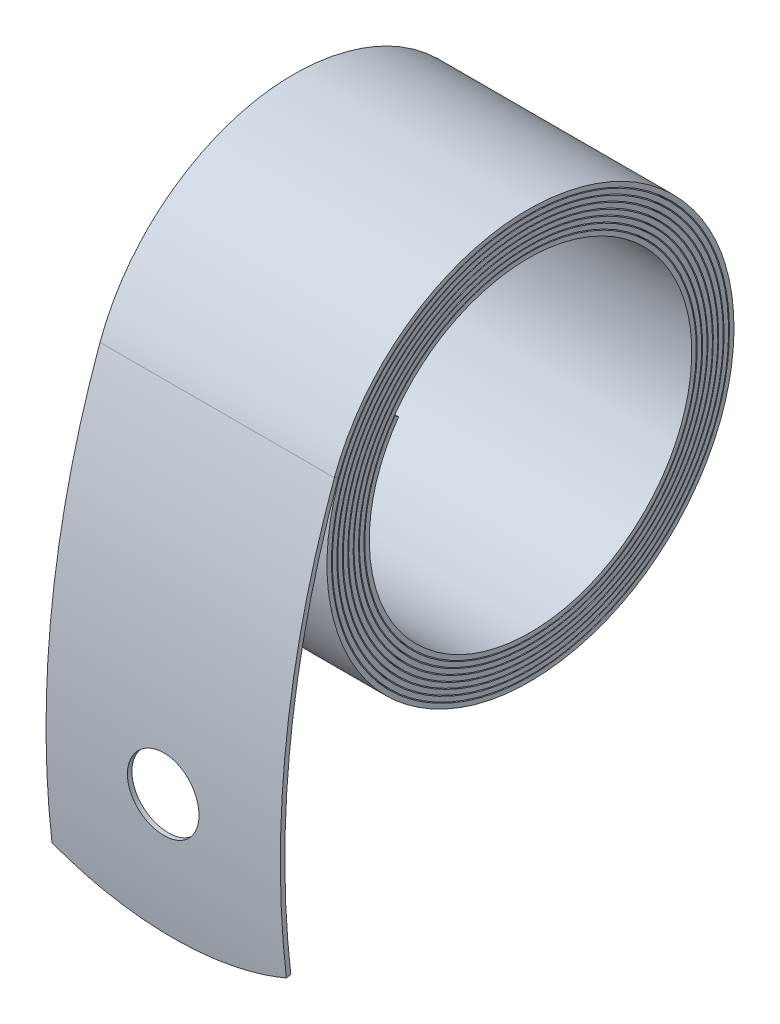
from build123d import *

# Parameters (mm, degrees)
SWEEP1_START            = -7.9375
SWEEP1_DEPTH            = 15.875
CUT_EXTRUDE1_START      = -16.85544
SKETCH7_R               = 2.4257
CUT_EXTRUDE1_DEPTH      = 0.35359
CUT_EXTRUDE2_REACH      = 51.601
CUT_EXTRUDE2_END_RADIUS = 60.32342755


# Read off the part's stored shape, not the designer's step: Sweep1
with BuildPart() as part:
    # Sweep1 outline → Sweep1 (new body)
    with BuildSketch(Plane.YZ.offset(SWEEP1_START)):
        with BuildLine():
            add(Edge.make_bspline(
                [(4.699242082, 12.912908186), (6.395060697, 12.287619771), (7.965017815, 11.323405234), (11.602853027, 7.948237166), (13.134824058, 4.980061507), (13.967034142, -1.264046067), (13.258759366, -4.517388005), (9.928450801, -9.843572635), (7.319403537, -11.896337015), (1.376497278, -13.870441354), (-1.933381846, -13.790349243), (-7.753805311, -11.5353146), (-10.244207049, -9.368638087), (-13.287749645, -3.938118098), (-13.824837394, -0.691921503), (-12.710682309, 5.414852583), (-11.064045327, 8.252226449), (-6.327290896, 12.234201405), (-3.258667915, 13.368730501), (2.909016065, 13.422421691), (5.986606982, 12.341827769), (10.763271714, 8.466212581), (12.441171988, 5.681548978), (13.646910627, -0.332271277), (13.170508656, -3.538414758), (10.274637266, -8.923172378), (7.871222738, -11.084691701), (2.228134103, -13.384785663), (-0.991777141, -13.515770354), (-6.791490356, -11.700711085), (-9.348075581, -9.756464626), (-12.649511028, -4.675406946), (-13.382059771, -1.55820071), (-12.688449236, 4.441822883), (-11.270785511, 7.30308761), (-6.929764819, 11.473587502), (-4.02175236, 12.76867842), (1.96438175, 13.218656974), (5.020532148, 12.366738483), (9.904833456, 8.907261307), (11.714520077, 6.31322956), (13.266904043, 0.552834612), (13.009530703, -2.590647459), (10.546628705, -8.002233868), (8.350010196, -10.25180067), (3.019995317, -12.848599997), (-0.095709603, -13.181583102), (-5.840438211, -11.788310592), (-8.447555513, -10.06774493), (-11.973531427, -5.347450306), (-12.88397394, -2.368691422), (-12.597712046, 3.49593191), (-11.402425856, 6.361579571), (-7.458399657, 10.688726443), (-4.72071016, 12.130704988), (1.059053214, 12.94750291), (4.078921446, 12.319554171), (9.035955292, 9.274210388), (10.957746879, 6.872983236), (12.833945632, 1.387438121), (12.782300852, -1.677853957), (10.74162658, -7.086484365), (8.755632702, -9.407885168), (3.750618085, -12.265040336), (0.75098811, -12.790147148), (-4.907374887, -11.803829929), (-7.546105952, -10.301627221), (-11.267626342, -5.953275521), (-12.337960127, -3.122342706), (-12.438047027, 2.583503677), (-11.462601651, 5.437182641), (-7.913064999, 9.883074563), (-5.352900844, 11.458430558), (0.197128419, 12.616719413), (3.165284606, 12.200812534), (8.164209778, 9.569054855), (10.178050341, 7.362603248), (12.350022842, 2.165558314), (12.495658996, -0.807444852), (10.86083895, -6.179144985), (9.087024209, -8.557277573), (4.419084747, -11.642782038), (1.54529013, -12.343299305), (-3.998550034, -11.751913059), (-6.649692148, -10.462459418), (-10.535874595, -6.48812411), (-11.753053665, -3.814832188), (-12.211801057, 1.707029652), (-11.451966684, 4.534291201), (-8.296116741, 9.064977771), (-5.916240473, 10.754703886), (-0.617344591, 12.232905252), (2.28349366, 12.016755927), (7.295141896, 9.788948496), (9.385355455, 7.781423849), (11.818248333, 2.885811215), (12.151867525, 0.016777643), (10.909521489, -5.287048647), (9.34335531, -7.703399105), (5.024102772, -10.98941265), (2.285964196, -11.848245175), (-3.120139443, -11.632026342), (-5.767714979, -10.553276364), (-9.781666782, -6.951923811), (-11.132776073, -4.443511002), (-11.926347396, 0.870875432), (-11.371066465, 3.656374483), (-8.609171263, 8.241915708), (-6.412291983, 10.026630213), (-1.378479348, 11.797893867), (1.441104977, 11.773640194), (6.431893261, 9.935131271), (8.583908741, 8.128335016), (11.247038474, 3.546890423), (11.752757593, 0.7918258), (10.891934854, -4.416498198), (9.528729126, -6.852215349), (5.560943166, -10.308836658), (2.968340001, -11.313533418), (-2.274550973, -11.446520067), (-4.904507843, -10.574660636), (-9.013252053, -7.346576724), (-10.479959533, -5.006327102), (-11.587950829, 0.079278706), (-11.225919736, 2.80739528), (-8.849345404, 7.419264398), (-6.839890387, 9.283811661), (-2.084970078, 11.31477388), (0.641892275, 11.473641246), (5.581373645, 10.012404435), (7.777107358, 8.402530525), (10.643742368, 4.147206022), (11.305364014, 1.516301768), (10.807450158, -3.573529705), (9.645601207, -6.013010931), (6.029598115, -9.604397122), (3.589762296, -10.742597416), (-1.466387582, -11.202376094), (-4.063512062, -10.527171251), (-8.237999239, -7.673337558), (-9.801614489, -5.504629005), (-11.198307412, -0.661965883), (-11.022204461, 1.995013892), (-9.017923431, 6.60010066), (-7.197887337, 8.530418099), (-2.735147925, 10.79168722), (-0.111185148, 11.118594378), (3.708251748, 10.259070203), (5.033952092, 9.668748066), (6.193364993, 8.847827478)],
                knots=[9.1e-07, 9.1e-07, 9.1e-07, 9.1e-07, 0.0078125, 0.0078125, 0.021484375, 0.021484375, 0.03515625, 0.03515625, 0.048828125, 0.048828125, 0.0625, 0.0625, 0.076171875, 0.076171875, 0.08984375, 0.08984375, 0.103515625, 0.103515625, 0.1171875, 0.1171875, 0.130859375, 0.130859375, 0.14453125, 0.14453125, 0.158203125, 0.158203125, 0.171875, 0.171875, 0.185546875, 0.185546875, 0.19921875, 0.19921875, 0.212890625, 0.212890625, 0.2265625, 0.2265625, 0.240234375, 0.240234375, 0.25390625, 0.25390625, 0.267578125, 0.267578125, 0.28125, 0.28125, 0.294921875, 0.294921875, 0.30859375, 0.30859375, 0.322265625, 0.322265625, 0.3359375, 0.3359375, 0.349609375, 0.349609375, 0.36328125, 0.36328125, 0.376953125, 0.376953125, 0.390625, 0.390625, 0.404296875, 0.404296875, 0.41796875, 0.41796875, 0.431640625, 0.431640625, 0.4453125, 0.4453125, 0.458984375, 0.458984375, 0.47265625, 0.47265625, 0.486328125, 0.486328125, 0.5, 0.5, 0.513671875, 0.513671875, 0.52734375, 0.52734375, 0.541015625, 0.541015625, 0.5546875, 0.5546875, 0.568359375, 0.568359375, 0.58203125, 0.58203125, 0.595703125, 0.595703125, 0.609375, 0.609375, 0.623046875, 0.623046875, 0.63671875, 0.63671875, 0.650390625, 0.650390625, 0.6640625, 0.6640625, 0.677734375, 0.677734375, 0.69140625, 0.69140625, 0.705078125, 0.705078125, 0.71875, 0.71875, 0.732421875, 0.732421875, 0.74609375, 0.74609375, 0.759765625, 0.759765625, 0.7734375, 0.7734375, 0.787109375, 0.787109375, 0.80078125, 0.80078125, 0.814453125, 0.814453125, 0.828125, 0.828125, 0.841796875, 0.841796875, 0.85546875, 0.85546875, 0.869140625, 0.869140625, 0.8828125, 0.8828125, 0.896484375, 0.896484375, 0.91015625, 0.91015625, 0.923828125, 0.923828125, 0.9375, 0.9375, 0.951171875, 0.951171875, 0.96484375, 0.96484375, 0.978515625, 0.978515625, 0.9921875, 0.9921875, 1, 1, 1, 1], degree=3))
            Line((6.193364993, 8.847827478), (6.369497497, 9.096585154))
            add(Edge.make_bspline(
                [(4.804083337, 13.19911049), (6.538221752, 12.559784455), (8.14239518, 11.574617025), (11.862271165, 8.123331838), (13.427694765, 5.08978985), (14.278420242, -1.293239505), (13.554167618, -4.619855914), (10.149919361, -10.064292785), (7.481992025, -12.163504904), (1.406079732, -14.181790957), (-1.97721365, -14.100243887), (-7.93020261, -11.793848757), (-10.475835752, -9.578784959), (-13.587898243, -4.026006565), (-14.137203632, -0.705815543), (-12.998016816, 5.538159485), (-11.313820143, 8.440445053), (-6.469785066, 12.512605991), (-3.332402099, 13.672900176), (2.977443734, 13.72782892), (6.12423311, 12.622670457), (11.00973092, 8.658751996), (12.726316257, 5.809839515), (13.959471417, -0.340725161), (13.472142387, -3.621063407), (10.509889037, -9.129255641), (8.052093915, -11.34011594), (2.277353864, -13.693870344), (-1.015935738, -13.8275875), (-6.949402252, -11.970669235), (-9.565668471, -9.981006501), (-12.943090915, -4.783001416), (-13.692890643, -1.592811129), (-12.983185496, 4.54643765), (-11.533211859, 7.473640653), (-7.089670266, 11.742634295), (-4.114477814, 13.067368165), (2.011412404, 13.527852206), (5.13979873, 12.655773441), (10.137910222, 9.115686222), (11.990585926, 6.460203588), (13.579438851, 0.564484121), (13.316395958, -2.652207571), (10.794603445, -8.193190567), (8.546504822, -10.495118239), (3.090497273, -13.153301576), (-0.099781893, -13.494231698), (-5.98004721, -12.068087389), (-8.649811538, -10.306295183), (-12.259661946, -5.473716092), (-13.191877071, -2.424830524), (-12.898684002, 3.581791205), (-11.674898529, 6.515112056), (-7.636462554, 10.94583962), (-4.832407738, 12.422748451), (1.085449518, 13.259061843), (4.178762346, 12.615941626), (9.255213554, 9.497234027), (11.223140506, 7.038881287), (13.14534758, 1.41881912), (13.092215009, -1.719887285), (11.002066318, -7.259645353), (8.96730219, -9.638019403), (3.841167356, -12.564317077), (0.767682614, -13.102453133), (-5.028751175, -12.0920686), (-7.731455327, -10.553820706), (-11.545416391, -6.097458162), (-12.641484236, -3.19775295), (-12.744029156, 2.648222503), (-11.744306169, 5.572859861), (-8.107753012, 10.127742339), (-5.483769229, 11.742485494), (0.203456827, 12.929407264), (3.244376061, 12.503633423), (8.36910025, 9.805647003), (10.432257099, 7.544791386), (12.658272274, 2.218434408), (12.807556973, -0.829476652), (11.132130737, -6.334600814), (9.313557445, -8.772907906), (4.528698811, -11.935695855), (1.583642011, -12.653919793), (-4.101563809, -12.04745344), (-6.81862964, -10.725658434), (-10.802796085, -6.651116492), (-12.051033782, -3.909561296), (-12.521328032, 1.751288049), (-11.742126248, 4.651001017), (-8.506170349, 9.296691464), (-6.066611213, 11.029193594), (-0.630776101, 12.54559608), (2.343269825, 12.323741942), (7.482985628, 10.03900516), (9.62727529, 7.979516134), (12.122234886, 2.959009137), (12.464616806, 0.015493852), (11.190307061, -5.424791972), (9.584478043, -7.902938054), (5.152079522, -11.27503113), (2.343802827, -12.155602135), (-3.202339743, -11.9337824), (-5.919361027, -10.826716014), (-10.037121413, -7.132225494), (-11.423884209, -4.557834318), (-12.238154421, 0.895168377), (-11.668839958, 3.752743136), (-8.833593641, 8.46006833), (-6.579565082, 10.290890168), (-1.413547189, 12.108673307), (1.481031135, 12.083755776), (6.602688649, 10.197037184), (8.812206046, 8.342096837), (11.545769783, 3.639482972), (12.06506928, 0.812255829), (11.181063767, -4.536333285), (9.781779833, -7.036005878), (5.708319206, -10.584687924), (3.045779724, -11.616467186), (-2.33653308, -11.752990289), (-5.037708102, -10.85762967), (-9.256660295, -7.542959541), (-10.762641402, -5.14066601), (-11.900896658, 0.083849338), (-11.528960639, 2.884724674), (-9.088186889, 7.621176183), (-7.023743766, 9.53672216), (-2.14056636, 11.622466646), (0.661158536, 11.785799223), (5.735035952, 10.2848043), (7.990182331, 8.631779394), (10.936247872, 4.258545676), (11.615538559, 1.556368985), (11.103979517, -3.672947862), (9.909867081, -6.180131665), (6.194909766, -9.869798421), (3.687154114, -11.039798751), (-1.508573484, -11.512269865), (-4.176847468, -10.818909285), (-8.468698517, -7.884841312), (-10.075057938, -5.656425963), (-11.510589403, -0.679100474), (-11.329510197, 2.052711243), (-9.269571716, 6.785677974), (-7.398163615, 8.770633046), (-2.810403716, 11.095250021), (-0.113616488, 11.431564169), (3.814798724, 10.547515568), (5.176949006, 9.940967347), (6.369497497, 9.096585154)],
                knots=[0, 0, 0, 0, 0.0078125, 0.0078125, 0.021484375, 0.021484375, 0.03515625, 0.03515625, 0.048828125, 0.048828125, 0.0625, 0.0625, 0.076171875, 0.076171875, 0.08984375, 0.08984375, 0.103515625, 0.103515625, 0.1171875, 0.1171875, 0.130859375, 0.130859375, 0.14453125, 0.14453125, 0.158203125, 0.158203125, 0.171875, 0.171875, 0.185546875, 0.185546875, 0.19921875, 0.19921875, 0.212890625, 0.212890625, 0.2265625, 0.2265625, 0.240234375, 0.240234375, 0.25390625, 0.25390625, 0.267578125, 0.267578125, 0.28125, 0.28125, 0.294921875, 0.294921875, 0.30859375, 0.30859375, 0.322265625, 0.322265625, 0.3359375, 0.3359375, 0.349609375, 0.349609375, 0.36328125, 0.36328125, 0.376953125, 0.376953125, 0.390625, 0.390625, 0.404296875, 0.404296875, 0.41796875, 0.41796875, 0.431640625, 0.431640625, 0.4453125, 0.4453125, 0.458984375, 0.458984375, 0.47265625, 0.47265625, 0.486328125, 0.486328125, 0.5, 0.5, 0.513671875, 0.513671875, 0.52734375, 0.52734375, 0.541015625, 0.541015625, 0.5546875, 0.5546875, 0.568359375, 0.568359375, 0.58203125, 0.58203125, 0.595703125, 0.595703125, 0.609375, 0.609375, 0.623046875, 0.623046875, 0.63671875, 0.63671875, 0.650390625, 0.650390625, 0.6640625, 0.6640625, 0.677734375, 0.677734375, 0.69140625, 0.69140625, 0.705078125, 0.705078125, 0.71875, 0.71875, 0.732421875, 0.732421875, 0.74609375, 0.74609375, 0.759765625, 0.759765625, 0.7734375, 0.7734375, 0.787109375, 0.787109375, 0.80078125, 0.80078125, 0.814453125, 0.814453125, 0.828125, 0.828125, 0.841796875, 0.841796875, 0.85546875, 0.85546875, 0.869140625, 0.869140625, 0.8828125, 0.8828125, 0.896484375, 0.896484375, 0.91015625, 0.91015625, 0.923828125, 0.923828125, 0.9375, 0.9375, 0.951171875, 0.951171875, 0.96484375, 0.96484375, 0.978515625, 0.978515625, 0.9921875, 0.9921875, 1, 1, 1, 1], degree=3))
            ThreePointArc((4.804083337, 13.19911049), (-9.732457579, 16.53764067), (-24.644191739, 16.226208667))
            Line((-24.644191739, 16.226208667), (-24.600392363, 15.92457204))
            ThreePointArc((-24.600392363, 15.92457204), (-9.763939022, 16.234470653), (4.699242082, 12.912908186))
        make_face()
    extrude(amount=SWEEP1_DEPTH)

    # Sketch7 → Cut-Extrude1 (cut)
    with BuildSketch(Plane(origin=(0, -4.268002453, 0), x_dir=(1, 0, 0), z_dir=(0, 0, -1)).offset(CUT_EXTRUDE1_START)):
        with Locations((0, 11.663989286)):
            Circle(SKETCH7_R)
    extrude(amount=CUT_EXTRUDE1_DEPTH, mode=Mode.SUBTRACT)

    # Cut-Extrude2: up to this cylinder (the profile starts outside it)
    cut_extrude2_end = Plane(origin=(7.777512, -15.931991739, -43.77278755), z_dir=(-1, 0, 0)) * Cylinder(CUT_EXTRUDE2_END_RADIUS, 224.848855099, mode=Mode.PRIVATE)
    # Sketch8 → Cut-Extrude2 (cut, up to the surface)
    with BuildSketch(Plane(origin=(0, -24.644191739, 16.226208667), x_dir=(-1, 0, 0), z_dir=(0, 0.14369874152861697, -0.9896214789923933)), mode=Mode.PRIVATE) as cut_extrude2_sk1:
        with BuildLine():
            Line((-7.9375, 1.732419518), (-7.9375, -0.254))
            Line((-7.9375, -0.254), (7.9375, -0.254))
            Line((7.9375, -0.254), (7.9375, 1.732419518))
            ThreePointArc((7.9375, 1.732419518), (0, 0), (-7.9375, 1.732419518))
        make_face()
    cut_extrude2_tool1 = extrude(cut_extrude2_sk1.sketch, amount=CUT_EXTRUDE2_REACH, mode=Mode.PRIVATE) - cut_extrude2_end
    add(cut_extrude2_tool1.solids().sort_by_distance((7.777512, -23.912654, 16.332432))[0], mode=Mode.SUBTRACT)


solid = part.part
